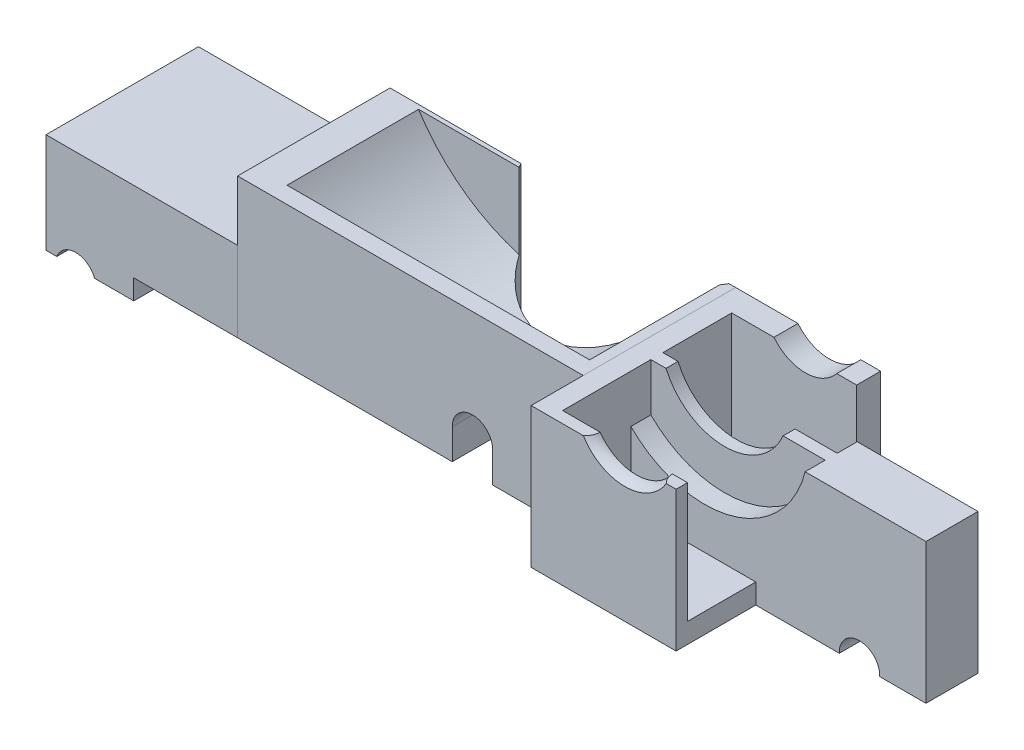
from build123d import *

# Parameters (mm, degrees)
SKETCH1_W           = 419.1
SKETCH1_H           = 142.18412
BOSS_EXTRUDE1_DEPTH = 88.9
SKETCH2_R           = 119.38
CUT_EXTRUDE1_DEPTH  = 83.4009
SKETCH7_W           = 187.160719179
SKETCH7_H           = 30.93974
SKETCH7_H_2         = 43.28668
CUT_EXTRUDE2_DEPTH  = 452.402640644
SKETCH4_R           = 40.386
CUT_EXTRUDE4_DEPTH  = 7.62
CUT_EXTRUDE17_START = -12.7
CUT_EXTRUDE17_DEPTH = 12.7
CUT_EXTRUDE18_DEPTH = 12.7
SKETCH18_R          = 25.527
CUT_EXTRUDE11_DEPTH = 23.09114
SKETCH8_W           = 419.1
SKETCH8_H           = 88.9
CUT_EXTRUDE6_DEPTH  = 7.85114
SKETCH9_W           = 419.1
SKETCH9_H           = 88.9
CUT_EXTRUDE7_DEPTH  = 7.14248
SKETCH10_W          = 219.202
SKETCH10_H          = 88.9
CUT_EXTRUDE8_DEPTH  = 30.48
SKETCH12_W          = 121.533574186
SKETCH12_H          = 96.7105
BOSS_EXTRUDE2_DEPTH = 50.8
SKETCH14_W          = 55.647095764
SKETCH14_H          = 96.7105
BOSS_EXTRUDE3_DEPTH = 12.7
CUT_EXTRUDE10_REACH = 448.907
SKETCH17_R          = 12.827
SKETCH22_W          = 199.898
SKETCH22_H          = 88.9
BOSS_EXTRUDE5_DEPTH = 2.54
SKETCH29_R          = 12.827
CUT_EXTRUDE14_DEPTH = 447.906526346
BOSS_EXTRUDE6_DEPTH = 86.10092
SKETCH45_W          = 107.95
SKETCH45_H          = 50.53076
SKETCH45_H_2        = 15.24
CUT_EXTRUDE22_DEPTH = 452.677672269
SKETCH46_W          = 91.948
SKETCH46_H          = 129.7305
BOSS_EXTRUDE7_DEPTH = 12.7
CUT_EXTRUDE23_DEPTH = 452.677672176
SPLIT1_DEPTH        = 50.8
SPLIT1_START        = -4.447045482
SPLIT1_2_OUTLINE_W  = 55.647095764
SPLIT1_2_OUTLINE_H  = 96.7105
SPLIT1_2_DEPTH      = 4.447045482
SPLIT1_START_2      = -134.33298
SPLIT1_3_DEPTH      = 96.7105
SPLIT1_START_3      = -12.7
SPLIT1_4_DEPTH      = 63.5
SPLIT3_DEPTH        = 88.9
SPLIT3_START        = 50.8
SPLIT3_2_OUTLINE_W  = 25.654
SPLIT3_2_OUTLINE_H  = 10.60958
SPLIT3_2_DEPTH      = 38.1
SPLIT3_START_2      = 19.31637732
SPLIT3_3_DEPTH      = 31.48362268
SPLIT3_START_3      = -131.63296
SPLIT3_4_DEPTH      = 83.4009
SPLIT3_START_4      = -48.23206
SPLIT3_5_DEPTH      = 10.60958
SPLIT3_6_DEPTH      = 88.9
SPLIT3_7_DEPTH      = 38.1


with BuildPart() as part:
    # Sketch1 → Boss-Extrude1 (new body)
    with BuildSketch(Plane(origin=(0, 0, 0), x_dir=(1, 0, 0), z_dir=(0, 1, 0))):
        with Locations((209.55, 71.09206)):
            Rectangle(SKETCH1_W, SKETCH1_H)
    extrude(amount=BOSS_EXTRUDE1_DEPTH)

    # Sketch2 → Cut-Extrude1 (cut)
    with BuildSketch(Plane(origin=(0, 0, -131.63296), x_dir=(-1, 0, 0), z_dir=(0, 0, -1))):
        with Locations((-116.7166499, 150.061217688)):
            Circle(SKETCH2_R)
    extrude(amount=-CUT_EXTRUDE1_DEPTH, mode=Mode.SUBTRACT)

    # Sketch7 → Cut-Extrude2 (cut, through all)
    with BuildSketch(Plane(origin=(0, 88.9, 0), x_dir=(1, 0, 0), z_dir=(0, 1, 0))):
        with Locations((325.519640411, 103.62311)):
            Rectangle(SKETCH7_W, SKETCH7_H)
        with Locations((325.519640411, 33.4899)):
            Rectangle(SKETCH7_W, SKETCH7_H_2)
    extrude(amount=-CUT_EXTRUDE2_DEPTH, mode=Mode.SUBTRACT)

    # Sketch4 → Cut-Extrude4 (cut)
    with BuildSketch(Plane(origin=(0, 0, -67.83324), x_dir=(-1, 0, 0), z_dir=(0, 0, -1))):
        with Locations((-278.649352085, 104.852009966)):
            Circle(SKETCH4_R)
    extrude(amount=CUT_EXTRUDE4_DEPTH, mode=Mode.SUBTRACT)

    # Sketch39 → Cut-Extrude17 (cut)
    with BuildSketch(Plane.XY.offset(-55.13324).offset(CUT_EXTRUDE17_START)):
        with BuildLine():
            Line((231.939280821, 58.527426444), (231.939280821, 88.9))
            Line((231.939280821, 88.9), (342.472006166, 88.9))
            ThreePointArc((342.472006166, 88.9), (296.080170447, 41.417284719), (231.939280821, 58.527426444))
        make_face()
    extrude(amount=CUT_EXTRUDE17_DEPTH, mode=Mode.SUBTRACT)

    # Sketch40 → Cut-Extrude18 (cut)
    with BuildSketch(Plane(origin=(0, 0, -88.15324), x_dir=(-1, 0, 0), z_dir=(0, 0, -1))):
        with BuildLine():
            Line((-231.939280821, 88.9), (-231.939280821, 58.527426444))
            ThreePointArc((-231.939280821, 58.527426444), (-296.080170447, 41.417284719), (-342.472006166, 88.9))
            Line((-342.472006166, 88.9), (-231.939280821, 88.9))
        make_face()
    extrude(amount=-CUT_EXTRUDE18_DEPTH, mode=Mode.SUBTRACT)

    # Sketch18 → Cut-Extrude11 (cut)
    with BuildSketch(Plane(origin=(0, 0, -142.18412), x_dir=(-1, 0, 0), z_dir=(0, 0, -1))):
        with Locations((-278.649352085, 104.852009966)):
            Circle(SKETCH18_R)
    extrude(amount=-CUT_EXTRUDE11_DEPTH, mode=Mode.SUBTRACT)

    # Sketch8 → Cut-Extrude6 (cut)
    with BuildSketch(Plane(origin=(0, 0, -142.18412), x_dir=(-1, 0, 0), z_dir=(0, 0, -1))):
        with Locations((-209.55, 44.45)):
            Rectangle(SKETCH8_W, SKETCH8_H)
    extrude(amount=-CUT_EXTRUDE6_DEPTH, mode=Mode.SUBTRACT)

    # Sketch9 → Cut-Extrude7 (cut)
    with BuildSketch(Plane.XY):
        with Locations((209.55, 44.45)):
            Rectangle(SKETCH9_W, SKETCH9_H)
    extrude(amount=-CUT_EXTRUDE7_DEPTH, mode=Mode.SUBTRACT)

    # Sketch10 → Cut-Extrude8 (cut)
    with BuildSketch(Plane.XY.offset(-7.14248)):
        with Locations((109.601, 44.45)):
            Rectangle(SKETCH10_W, SKETCH10_H)
    extrude(amount=-CUT_EXTRUDE8_DEPTH, mode=Mode.SUBTRACT)

    # Sketch12 → Boss-Extrude2 (add)
    with BuildSketch(Plane.XZ):
        with Locations((-60.766787093, -85.97773)):
            Rectangle(SKETCH12_W, SKETCH12_H)
    extrude(amount=-BOSS_EXTRUDE2_DEPTH)

    # Sketch14 → Boss-Extrude3 (add)
    with BuildSketch(Plane.XZ):
        with Locations((-93.710026304, -85.97773)):
            Rectangle(SKETCH14_W, SKETCH14_H)
    extrude(amount=BOSS_EXTRUDE3_DEPTH)

    # Cut-Extrude10: up to this face of the body (flat: up to its plane)
    cut_extrude10_end = Plane(part.part.faces().sort_by_distance((319.151, 44.45, -7.14248))[0])
    # Sketch17 → Cut-Extrude10 (cut, up to the picked face)
    with BuildSketch(Plane(origin=(0, 0, -134.33298), x_dir=(-1, 0, 0), z_dir=(0, 0, -1)), mode=Mode.PRIVATE) as cut_extrude10_sk1:
        with Locations((-376.94362, 0.531880938)):
            Circle(SKETCH17_R)
    cut_extrude10_tool1 = split(extrude(cut_extrude10_sk1.sketch, amount=-CUT_EXTRUDE10_REACH, mode=Mode.PRIVATE), bisect_by=cut_extrude10_end, keep=Keep.BOTH, mode=Mode.PRIVATE)
    # Sketch17 → Cut-Extrude10 (cut, up to the picked face)
    with BuildSketch(Plane(origin=(0, 0, -134.33298), x_dir=(-1, 0, 0), z_dir=(0, 0, -1)), mode=Mode.PRIVATE) as cut_extrude10_sk2:
        with Locations((102.701238422, -17.274045482)):
            Circle(SKETCH17_R)
    cut_extrude10_tool2 = split(extrude(cut_extrude10_sk2.sketch, amount=-CUT_EXTRUDE10_REACH, mode=Mode.PRIVATE), bisect_by=cut_extrude10_end, keep=Keep.BOTH, mode=Mode.PRIVATE)
    # Sketch17 → Cut-Extrude10 (cut, up to the picked face)
    with BuildSketch(Plane(origin=(0, 0, -134.33298), x_dir=(-1, 0, 0), z_dir=(0, 0, -1)), mode=Mode.PRIVATE) as cut_extrude10_sk3:
        with BuildLine():
            Line((-161.80562, 19.31637742), (-161.80562, 0))
            Line((-161.80562, 0), (-136.15162, 0))
            Line((-136.15162, 0), (-136.15162, 19.31637742))
            ThreePointArc((-136.15162, 19.31637742), (-148.97862, 32.14337742), (-161.80562, 19.31637742))
        make_face()
    cut_extrude10_tool3 = split(extrude(cut_extrude10_sk3.sketch, amount=-CUT_EXTRUDE10_REACH, mode=Mode.PRIVATE), bisect_by=cut_extrude10_end, keep=Keep.BOTH, mode=Mode.PRIVATE)
    add(cut_extrude10_tool1.solids().sort_by(Axis((376.94362, 0.531881, -134.33298), (0, 0, 1)))[0], mode=Mode.SUBTRACT)
    add(cut_extrude10_tool2.solids().sort_by(Axis((-102.701238, -17.274045, -134.33298), (0, 0, 1)))[0], mode=Mode.SUBTRACT)
    add(cut_extrude10_tool3.solids().sort_by(Axis((148.97862, 14.834778, -134.33298), (0, 0, 1)))[0], mode=Mode.SUBTRACT)

    # Sketch22 → Boss-Extrude5 (add)
    with BuildSketch(Plane.XY.offset(-7.14248)):
        with Locations((319.151, 44.45)):
            Rectangle(SKETCH22_W, SKETCH22_H)
    extrude(amount=BOSS_EXTRUDE5_DEPTH)

    # Sketch29 → Cut-Extrude14 (cut, through all)
    with BuildSketch(Plane(origin=(0, 0, -7.14248), x_dir=(-1, 0, 0), z_dir=(0, 0, -1))):
        with Locations((-376.94362, 0.531880938)):
            Circle(SKETCH29_R)
    extrude(amount=-CUT_EXTRUDE14_DEPTH, mode=Mode.SUBTRACT)

    # Sketch30 → Boss-Extrude6 (add)
    with BuildSketch(Plane(origin=(0, 0, -134.33298), x_dir=(-1, 0, 0), z_dir=(0, 0, -1))):
        with BuildLine():
            Line((-14.194018979, 88.9), (-20.758717893, 88.9))
            ThreePointArc((-20.758717893, 88.9), (-116.7166499, 36.269217688), (-212.674581906, 88.9))
            Line((-212.674581906, 88.9), (-219.239280821, 88.9))
            ThreePointArc((-219.239280821, 88.9), (-116.7166499, 30.681217688), (-14.194018979, 88.9))
        make_face()
    extrude(amount=-BOSS_EXTRUDE6_DEPTH)

    # Sketch44 → Cut-Revolve1 (revolve, cut)
    with BuildSketch(Plane(origin=(0, 104.852009966, 0), x_dir=(1, 0, 0), z_dir=(0, 1, 0))):
        with BuildLine():
            Line((278.649352085, 11.84656), (306.589352085, 11.84656))
            ThreePointArc((306.589352085, 11.84656), (307.31205993, 7.964449393), (309.383352085, 4.60248))
            Line((309.383352085, 4.60248), (278.649352085, 4.60248))
            Line((278.649352085, 4.60248), (278.649352085, 11.84656))
        make_face()
    revolve(axis=Axis((278.649352085, 104.852009966, -328.456473898), (0, 0, 1)), mode=Mode.SUBTRACT)

    # Sketch45 → Cut-Extrude22 (cut, through all)
    with BuildSketch(Plane(origin=(0, 88.9, 0), x_dir=(1, 0, 0), z_dir=(0, 1, 0))):
        with Locations((365.125, 29.86786)):
            Rectangle(SKETCH45_W, SKETCH45_H)
        with Locations((365.125, 126.71298)):
            Rectangle(SKETCH45_W, SKETCH45_H_2)
    extrude(amount=-CUT_EXTRUDE22_DEPTH, mode=Mode.SUBTRACT)

    # Sketch46 → Boss-Extrude7 (add)
    with BuildSketch(Plane.XZ):
        with Locations((265.176, -69.46773)):
            Rectangle(SKETCH46_W, SKETCH46_H)
    extrude(amount=-BOSS_EXTRUDE7_DEPTH)

    # Sketch47 → Cut-Extrude23 (cut, through all)
    with BuildSketch(Plane(origin=(0, 88.9, 0), x_dir=(1, 0, 0), z_dir=(0, 1, 0))):
        with BuildLine():
            Line((214.969755768, 134.33298), (82.987484232, 134.33298))
            ThreePointArc((82.987484232, 134.33298), (148.97862, 96.23298), (214.969755768, 134.33298))
        make_face()
    extrude(amount=-CUT_EXTRUDE23_DEPTH, mode=Mode.SUBTRACT)

    # Split1 4 outline → Split1 4 (cut)
    with BuildSketch(Plane(origin=(0, 0, 0), x_dir=(1, 0, 0), z_dir=(0, 1, 0)).offset(SPLIT1_START_3)):
        Polygon((0, 37.62248), (0, 71.576252628), (19.05, 60.57773), (19.05, 111.37773), (0, 100.379207372), (0, 134.33298), (-121.533574186, 134.33298), (-121.533574186, 37.62248), align=None)
    extrude(amount=SPLIT1_4_DEPTH, mode=Mode.SUBTRACT)

    # Split3 6 outline → Split3 6 (cut)
    with BuildSketch(Plane(origin=(0, 0, 0), x_dir=(1, 0, 0), z_dir=(0, 1, 0))):
        with BuildLine():
            Line((219.202, 37.62248), (219.202, 61.321002628))
            Line((219.202, 61.321002628), (200.152, 50.32248))
            Line((200.152, 50.32248), (200.152, 94.77248))
            Line((200.152, 94.77248), (219.202, 83.773957372))
            Line((219.202, 83.773957372), (219.202, 134.33298))
            Line((219.202, 134.33298), (214.969755768, 134.33298))
            ThreePointArc((214.969755768, 134.33298), (150.556684051, 96.249322213), (84.621814859, 131.63296))
            ThreePointArc((84.621814859, 131.63296), (83.790669029, 132.974507549), (82.987484232, 134.33298))
            Line((82.987484232, 134.33298), (0, 134.33298))
            Line((0, 134.33298), (0, 37.62248))
            Line((0, 37.62248), (219.202, 37.62248))
        make_face()
    extrude(amount=SPLIT3_6_DEPTH, mode=Mode.SUBTRACT)

    # Split3 7 outline → Split3 7 (cut)
    with BuildSketch(Plane(origin=(0, 0, 0), x_dir=(1, 0, 0), z_dir=(0, 1, 0)).offset(SPLIT3_START)):
        Polygon((200.152, 50.32248), (219.202, 61.321002628), (219.202, 83.773957372), (200.152, 94.77248), align=None)
    extrude(amount=SPLIT3_7_DEPTH, mode=Mode.SUBTRACT)


with BuildPart() as body_2:
    # Split1: read off the stored shape, not the designer's step
    # Split1 outline → Split1 (new body)
    with BuildSketch(Plane(origin=(0, 0, 0), x_dir=(1, 0, 0), z_dir=(0, 1, 0))):
        Polygon((19.05, 111.37773), (0, 100.379207372), (0, 134.33298), (-121.533574186, 134.33298), (-121.533574186, 37.62248), (0, 37.62248), (0, 71.576252628), (19.05, 60.57773), align=None)
    extrude(amount=SPLIT1_DEPTH)

    # Split1 2 outline → Split1 2 (add)
    with BuildSketch(Plane(origin=(0, 0, 0), x_dir=(1, 0, 0), z_dir=(0, 1, 0)).offset(SPLIT1_START)):
        with Locations((-93.710026304, 85.97773)):
            Rectangle(SPLIT1_2_OUTLINE_W, SPLIT1_2_OUTLINE_H)
    extrude(amount=SPLIT1_2_DEPTH)

    # Split1 3 outline → Split1 3 (add)
    with BuildSketch(Plane.XY.offset(SPLIT1_START_2)):
        with BuildLine():
            Line((-121.533574186, -4.447045482), (-121.533574186, -12.7))
            Line((-121.533574186, -12.7), (-114.684978945, -12.7))
            ThreePointArc((-114.684978945, -12.7), (-109.976561356, -6.709879391), (-102.701238422, -4.447045482))
            Line((-102.701238422, -4.447045482), (-121.533574186, -4.447045482))
        make_face()
        with BuildLine():
            Line((-65.886478422, -4.447045482), (-102.701238422, -4.447045482))
            ThreePointArc((-102.701238422, -4.447045482), (-95.425915488, -6.709879391), (-90.717497899, -12.7))
            Line((-90.717497899, -12.7), (-65.886478422, -12.7))
            Line((-65.886478422, -12.7), (-65.886478422, -4.447045482))
        make_face()
    extrude(amount=SPLIT1_3_DEPTH)


with BuildPart() as body_3:
    # Split3: read off the stored shape, not the designer's step
    # Split3 outline → Split3 (new body)
    with BuildSketch(Plane(origin=(0, 0, 0), x_dir=(1, 0, 0), z_dir=(0, 1, 0))):
        with BuildLine():
            Line((219.202, 83.773957372), (219.202, 134.33298))
            Line((219.202, 134.33298), (214.969755768, 134.33298))
            ThreePointArc((214.969755768, 134.33298), (192.516631386, 109.89593846), (161.80562, 97.320344106))
            Line((161.80562, 97.320344106), (161.80562, 48.23206))
            Line((161.80562, 48.23206), (161.80562, 37.62248))
            Line((161.80562, 37.62248), (219.202, 37.62248))
            Line((219.202, 37.62248), (219.202, 61.321002628))
            Line((219.202, 61.321002628), (200.152, 50.32248))
            Line((200.152, 50.32248), (200.152, 94.77248))
            Line((200.152, 94.77248), (219.202, 83.773957372))
        make_face()
        with BuildLine():
            Line((136.15162, 48.23206), (136.15162, 97.320344106))
            ThreePointArc((136.15162, 97.320344106), (106.745056968, 109.007699917), (84.621814859, 131.63296))
            ThreePointArc((84.621814859, 131.63296), (83.790669029, 132.974507549), (82.987484232, 134.33298))
            Line((82.987484232, 134.33298), (0, 134.33298))
            Line((0, 134.33298), (0, 100.379207372))
            Line((0, 100.379207372), (19.05, 111.37773))
            Line((19.05, 111.37773), (19.05, 60.57773))
            Line((19.05, 60.57773), (0, 71.576252628))
            Line((0, 71.576252628), (0, 37.62248))
            Line((0, 37.62248), (136.15162, 37.62248))
            Line((136.15162, 37.62248), (136.15162, 48.23206))
        make_face()
    extrude(amount=SPLIT3_DEPTH)

    # Split3 2 outline → Split3 2 (add)
    with BuildSketch(Plane(origin=(0, 0, 0), x_dir=(1, 0, 0), z_dir=(0, 1, 0)).offset(SPLIT3_START)):
        Polygon((219.202, 61.321002628), (219.202, 83.773957372), (200.152, 94.77248), (200.152, 50.32248), align=None)
        with Locations((148.97862, 42.92727)):
            Rectangle(SPLIT3_2_OUTLINE_W, SPLIT3_2_OUTLINE_H)
        Polygon((0, 100.379207372), (0, 71.576252628), (19.05, 60.57773), (19.05, 111.37773), align=None)
    extrude(amount=SPLIT3_2_DEPTH)

    # Split3 3 outline → Split3 3 (add)
    with BuildSketch(Plane(origin=(0, 0, 0), x_dir=(1, 0, 0), z_dir=(0, 1, 0)).offset(SPLIT3_START_2)):
        with BuildLine():
            ThreePointArc((161.80562, 97.320344106), (148.97862, 96.23298), (136.15162, 97.320344106))
            Line((136.15162, 97.320344106), (136.15162, 37.62248))
            Line((136.15162, 37.62248), (161.80562, 37.62248))
            Line((161.80562, 37.62248), (161.80562, 97.320344106))
        make_face()
    extrude(amount=SPLIT3_3_DEPTH)

    # Split3 4 outline → Split3 4 (cut)
    with BuildSketch(Plane.XY.offset(SPLIT3_START_3)):
        with BuildLine():
            ThreePointArc((161.80562, 19.31637742), (148.97862, 32.14337742), (136.15162, 19.31637742))
            Line((136.15162, 19.31637742), (161.80562, 19.31637742))
        make_face()
        with BuildLine():
            ThreePointArc((20.758717893, 88.9), (116.716649899, 36.269217688), (212.674581906, 88.9))
            Line((212.674581906, 88.9), (161.80562, 88.9))
            Line((161.80562, 88.9), (161.80562, 50.8))
            Line((161.80562, 50.8), (136.15162, 50.8))
            Line((136.15162, 50.8), (136.15162, 88.9))
            Line((136.15162, 88.9), (20.758717893, 88.9))
        make_face()
    extrude(amount=SPLIT3_4_DEPTH, mode=Mode.SUBTRACT)

    # Split3 5 outline → Split3 5 (cut)
    with BuildSketch(Plane.XY.offset(SPLIT3_START_4)):
        with BuildLine():
            ThreePointArc((161.80562, 19.31637742), (148.97862, 32.14337742), (136.15162, 19.31637742))
            Line((136.15162, 19.31637742), (161.80562, 19.31637742))
        make_face()
    extrude(amount=SPLIT3_5_DEPTH, mode=Mode.SUBTRACT)


solid = Compound([part.part, body_2.part, body_3.part])
